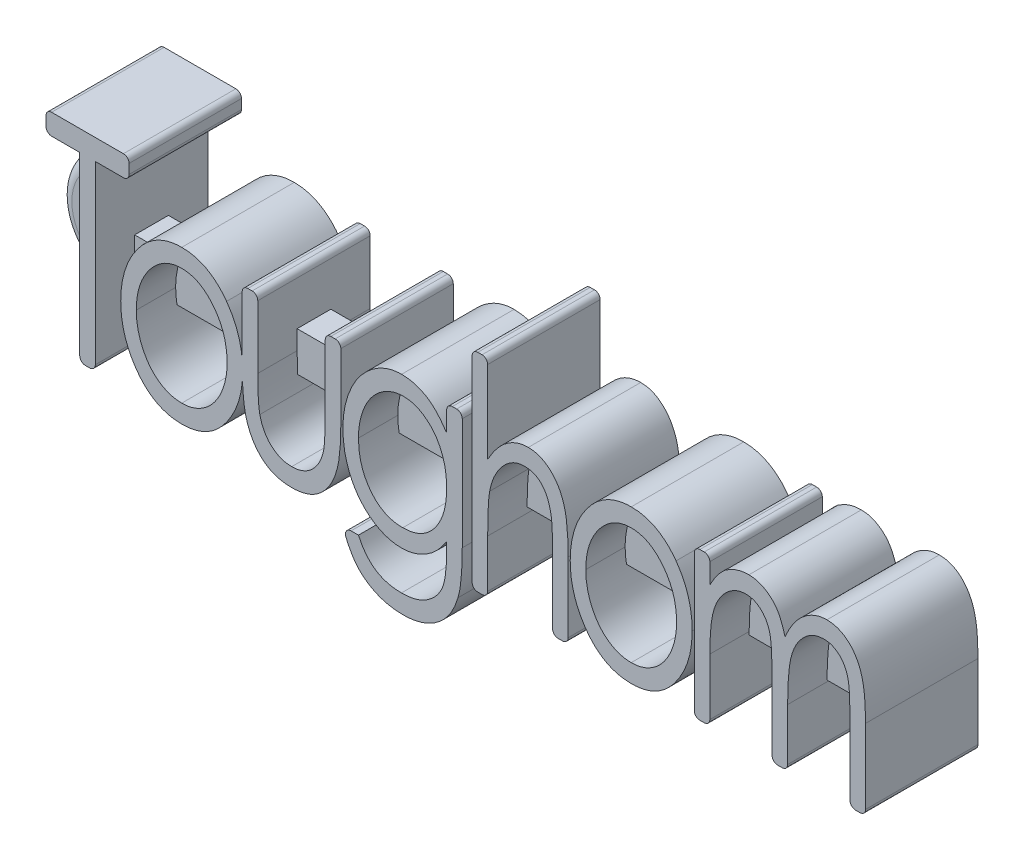
from build123d import *

# Parameters (mm, degrees)
SKETCH1_W           = 68.2
SKETCH1_H           = 3.5
BOSS_EXTRUDE1_DEPTH = 1.5
BOSS_EXTRUDE2_DEPTH = 5
BOSS_EXTRUDE3_DEPTH = 1.5
FILLET1_R           = 1
FILLET2_R           = 0.5
FILLET4_R           = 1


with BuildPart() as part:
    # Sketch1 → Boss-Extrude1 (new, symmetric)
    with BuildSketch(Plane.XY):
        Rectangle(SKETCH1_W, SKETCH1_H)
    extrude(amount=BOSS_EXTRUDE1_DEPTH, both=True)

    # Sketch2 → Boss-Extrude2 (add, symmetric)
    # profile 1 of 7: a face of its own
    with BuildSketch(Plane.XY):
        Polygon((-38.18110892, 9.153846154), (-38.18110892, 11), (-30.796493535, 11), (-30.796493535, 9.153846154), (-33.796493535, 9.153846154), (-33.796493535, -7), (-35.18110892, -7), (-35.18110892, 9.153846154), align=None)
    # profile 2 of 7: a face of its own
    with BuildSketch(Plane.XY):
        with BuildLine():
            add(Edge.make_bspline(
                [(-26.108272381, 6.384615385), (-25.911848075, 6.379244371), (-25.524505007, 6.368652887), (-24.958025603, 6.25854853), (-24.416971783, 6.088845342), (-23.899283468, 5.854648718), (-23.414217379, 5.541294481), (-22.950028442, 5.1693356), (-22.513883268, 4.725577941), (-22.25622825, 4.389933887), (-22.123897381, 4.217548077)],
                knots=[0, 0, 0, 0, 0.997600737, 1.967239891, 2.921995117, 3.876339565, 4.846055743, 5.850055787, 6.895794904, 8, 8, 8, 8], degree=3))
            add(Edge.make_bspline(
                [(-22.123897381, 4.217548077), (-22.009048053, 4.051200842), (-21.7795101, 3.718739135), (-21.490984784, 3.186587669), (-21.238251342, 2.63637492), (-21.036296082, 2.060464666), (-20.88276043, 1.461593169), (-20.770885034, 0.841057153), (-20.699877748, 0.198771914), (-20.692527722, -0.237793889), (-20.688801227, -0.459134615)],
                knots=[0, 0, 0, 0, 0.974492422, 1.947621278, 2.915467704, 3.892853539, 4.88708504, 5.894700399, 6.932604111, 8, 8, 8, 8], degree=3))
            add(Edge.make_bspline(
                [(-20.688801227, -0.459134615), (-20.694195567, -0.681642586), (-20.704834863, -1.120496664), (-20.772833197, -1.768393078), (-20.893252216, -2.394963139), (-21.057989931, -3.000740026), (-21.272008272, -3.586143933), (-21.535861783, -4.147188001), (-21.844362532, -4.689482978), (-22.19733513, -5.202442399), (-22.584945563, -5.676324223), (-23.006365549, -6.091513344), (-23.454730993, -6.445160413), (-23.934592931, -6.730800149), (-24.438510189, -6.957349096), (-24.970528248, -7.116592313), (-25.530304058, -7.212113552), (-25.913183248, -7.224472138), (-26.108272381, -7.230769231)],
                knots=[0, 0, 0, 0, 1.107894965, 2.185109244, 3.239066719, 4.281441704, 5.307577007, 6.338291467, 7.364845487, 8.410599108, 9.435040353, 10.408337498, 11.35046711, 12.27106388, 13.181883432, 14.094411748, 15.029042138, 16, 16, 16, 16], degree=3))
            add(Edge.make_bspline(
                [(-26.108272381, -7.230769231), (-26.303372718, -7.224509197), (-26.686273897, -7.212223342), (-27.247028901, -7.115981035), (-27.780691994, -6.958149345), (-28.285489577, -6.730671024), (-28.765590539, -6.445351844), (-29.213821049, -6.09032017), (-29.638928079, -5.677669716), (-30.026235973, -5.202252321), (-30.379442796, -4.689533297), (-30.687881424, -4.147174562), (-30.951751524, -3.58614752), (-31.165765419, -3.000739051), (-31.330504344, -2.394963405), (-31.450923033, -1.768393005), (-31.518921457, -1.120496683), (-31.52956074, -0.681642592), (-31.534955074, -0.459134615)],
                knots=[0, 0, 0, 0, 0.97035087, 1.904396978, 2.822082662, 3.732332818, 4.652354079, 5.593894721, 6.570857939, 7.594658757, 8.639758628, 9.6656709, 10.695741012, 11.721234828, 12.762958176, 13.816256772, 14.892797633, 16, 16, 16, 16], degree=3))
            add(Edge.make_bspline(
                [(-31.534955074, -0.459134615), (-31.531233022, -0.238986279), (-31.523872004, 0.196396194), (-31.452383447, 0.837321084), (-31.342907189, 1.45761268), (-31.18190411, 2.052013705), (-30.985028036, 2.628052803), (-30.734455867, 3.17788013), (-30.443115691, 3.70848836), (-30.214530355, 4.040283442), (-30.09985892, 4.206730769)],
                knots=[0, 0, 0, 0, 1.063876162, 2.104004247, 3.113779066, 4.10599887, 5.078075217, 6.053289624, 7.023419104, 8, 8, 8, 8], degree=3))
            add(Edge.make_bspline(
                [(-30.09985892, 4.206730769), (-29.967788876, 4.380568192), (-29.711180262, 4.718329721), (-29.272256358, 5.161474693), (-28.810530039, 5.539587942), (-28.320295334, 5.848945761), (-27.804298314, 6.08997582), (-27.26195255, 6.258201765), (-26.694505848, 6.368973013), (-26.305919428, 6.379341601), (-26.108272381, 6.384615385)],
                knots=[0, 0, 0, 0, 1.105877608, 2.148691041, 3.153713737, 4.125868282, 5.080095171, 6.03217926, 6.999105637, 8, 8, 8, 8], degree=3))
        make_face()
        with BuildLine():
            add(Edge.make_bspline(
                [(-26.11187815, 4.769230769), (-26.248025899, 4.764256564), (-26.517438982, 4.754413463), (-26.913419403, 4.679484246), (-27.294027126, 4.5609754), (-27.659823191, 4.392152394), (-28.009727116, 4.17394857), (-28.346480071, 3.909825808), (-28.665584069, 3.594644846), (-28.967675916, 3.239057506), (-29.243864891, 2.847935524), (-29.48509529, 2.432332892), (-29.692754291, 1.999070291), (-29.857650022, 1.542929391), (-29.993989813, 1.069173037), (-30.079359977, 0.572002319), (-30.141924728, 0.058077502), (-30.147501572, -0.291863245), (-30.150339689, -0.469951923)],
                knots=[0, 0, 0, 0, 0.892051984, 1.765218143, 2.632427219, 3.499707879, 4.398381485, 5.329923715, 6.299412897, 7.333506008, 8.385012576, 9.433681383, 10.480424421, 11.529892124, 12.610027243, 13.707297798, 14.833218744, 16, 16, 16, 16], degree=3))
            add(Edge.make_bspline(
                [(-30.150339689, -0.469951923), (-30.145024219, -0.69998656), (-30.134503161, -1.155300543), (-30.022795446, -1.823629075), (-29.861044253, -2.471033633), (-29.62247715, -3.083175498), (-29.329334497, -3.650482406), (-28.988417002, -4.161263064), (-28.590826756, -4.596671574), (-28.153728057, -4.965033779), (-27.678454519, -5.25312193), (-27.176631974, -5.461598792), (-26.652447695, -5.594988118), (-26.292955046, -5.608552313), (-26.11187815, -5.615384615)],
                knots=[0, 0, 0, 0, 1.139368929, 2.255184748, 3.350673064, 4.442866719, 5.503577089, 6.511720108, 7.47770502, 8.416871705, 9.336594054, 10.220769263, 11.103799257, 12, 12, 12, 12], degree=3))
            add(Edge.make_bspline(
                [(-26.11187815, -5.615384615), (-25.930788946, -5.608570518), (-25.571271862, -5.595042466), (-25.047268863, -5.461385009), (-24.545701571, -5.254331837), (-24.073127378, -4.96249254), (-23.632827491, -4.599330066), (-23.23938564, -4.159705483), (-22.897845296, -3.650718499), (-22.604638083, -3.083186794), (-22.367425007, -2.470445833), (-22.199771987, -1.824249328), (-22.089572791, -1.155218029), (-22.078839372, -0.699958865), (-22.073416612, -0.469951923)],
                knots=[0, 0, 0, 0, 0.896424748, 1.779675456, 2.664071664, 3.578931997, 4.522916774, 5.48514584, 6.493540845, 7.554516339, 8.646982988, 9.744251569, 10.860346286, 12, 12, 12, 12], degree=3))
            add(Edge.make_bspline(
                [(-22.073416612, -0.469951923), (-22.076408613, -0.291896079), (-22.082287837, 0.057980151), (-22.142689757, 0.572590697), (-22.236073403, 1.067949962), (-22.363644959, 1.544453734), (-22.53592782, 1.998199595), (-22.742076306, 2.432314717), (-22.983104466, 2.849106252), (-23.26367793, 3.23792943), (-23.565210031, 3.594734583), (-23.884416857, 3.910000807), (-24.220855902, 4.172578649), (-24.568781716, 4.394332086), (-24.935295, 4.559139189), (-25.314849812, 4.680308599), (-25.708796253, 4.754023341), (-25.976956896, 4.764140476), (-26.11187815, 4.769230769)],
                knots=[0, 0, 0, 0, 1.167383154, 2.293884921, 3.393164049, 4.471755392, 5.524513002, 6.571796016, 7.621005792, 8.677622853, 9.712249415, 10.68223872, 11.614261498, 12.506704025, 13.381600122, 14.241739258, 15.11535585, 16, 16, 16, 16], degree=3))
        make_face(mode=Mode.SUBTRACT)
    # profile 3 of 7: a face of its own
    with BuildSketch(Plane.XY):
        with BuildLine():
            Line((-20.734955074, 6.153846154), (-19.350339689, 6.153846154))
            Line((-19.350339689, 6.153846154), (-19.350339689, 0.052884615))
            add(Edge.make_bspline(
                [(-19.350339689, 0.052884615), (-19.349364506, -0.126203219), (-19.347499148, -0.468767768), (-19.341234309, -0.961626837), (-19.327359269, -1.411256426), (-19.305435417, -1.817504133), (-19.280101401, -2.180532716), (-19.252967924, -2.499409924), (-19.218238142, -2.776422087), (-19.185301645, -2.944850156), (-19.170051227, -3.022836538)],
                knots=[0, 0, 0, 0, 1.39320863, 2.664971002, 3.834342125, 4.892401155, 5.829707442, 6.665228822, 7.381967762, 8, 8, 8, 8], degree=3))
            add(Edge.make_bspline(
                [(-19.170051227, -3.022836538), (-19.120431115, -3.214646288), (-19.024519212, -3.585399948), (-18.791794556, -4.095365087), (-18.507455746, -4.547430598), (-18.155762075, -4.92766394), (-17.754416542, -5.231342745), (-17.314556358, -5.45847921), (-16.833930703, -5.591367629), (-16.501385248, -5.607289526), (-16.332310843, -5.615384615)],
                knots=[0, 0, 0, 0, 1.137446325, 2.198597258, 3.209033332, 4.197093238, 5.159258895, 6.089718797, 7.028765383, 8, 8, 8, 8], degree=3))
            add(Edge.make_bspline(
                [(-16.332310843, -5.615384615), (-16.163218593, -5.607265396), (-15.833276813, -5.591422744), (-15.358498335, -5.46130664), (-14.925448634, -5.244705137), (-14.539311251, -4.944586222), (-14.199040722, -4.579477706), (-13.918014772, -4.152785112), (-13.690096395, -3.674508671), (-13.589541107, -3.329852395), (-13.537839689, -3.152644231)],
                knots=[0, 0, 0, 0, 1.005630283, 1.962239226, 2.906425724, 3.871218594, 4.858679764, 5.865048311, 6.902295138, 8, 8, 8, 8], degree=3))
            add(Edge.make_bspline(
                [(-13.537839689, -3.152644231), (-13.522714668, -3.080658209), (-13.489096719, -2.92065694), (-13.450612912, -2.652237673), (-13.418926315, -2.331012846), (-13.39551911, -1.955691194), (-13.373096524, -1.527846111), (-13.359357193, -1.046956196), (-13.353195834, -0.514439912), (-13.351319954, -0.14182829), (-13.350339689, 0.052884615)],
                knots=[0, 0, 0, 0, 0.548823579, 1.219854442, 2.02220492, 2.957136236, 4.025854258, 5.219327833, 6.546924667, 8, 8, 8, 8], degree=3))
            Line((-13.350339689, 0.052884615), (-13.350339689, 6.153846154))
            Line((-13.350339689, 6.153846154), (-11.965724304, 6.153846154))
            Line((-11.965724304, 6.153846154), (-11.965724304, -0.25))
            add(Edge.make_bspline(
                [(-11.965724304, -0.25), (-11.967154549, -0.467557778), (-11.969928873, -0.889566337), (-11.989941061, -1.502975096), (-12.031427196, -2.073828496), (-12.079134276, -2.604712159), (-12.147863016, -3.091769782), (-12.228775315, -3.538967617), (-12.331143612, -3.942571122), (-12.475098623, -4.420579806), (-12.700840901, -4.958745616), (-13.036587882, -5.536092635), (-13.433491304, -6.042433909), (-13.817304209, -6.400110153), (-14.152791354, -6.64370257), (-14.418282851, -6.80329982), (-14.702664494, -6.93207878), (-15.000159872, -7.04131049), (-15.313547608, -7.127911196), (-15.642877708, -7.188592072), (-15.986499591, -7.225636652), (-16.220437153, -7.229037857), (-16.339522381, -7.230769231)],
                knots=[0, 0, 0, 0, 1.397698989, 2.71119214, 3.94186471, 5.07439274, 6.134732057, 7.100953584, 7.992391407, 8.808183655, 10.30677533, 11.729105738, 13.086992076, 14.425597192, 15.083568239, 15.748345675, 16.411686529, 17.08590401, 17.782777766, 18.49760152, 19.235208472, 20, 20, 20, 20], degree=3))
            add(Edge.make_bspline(
                [(-16.339522381, -7.230769231), (-16.459811867, -7.229077508), (-16.694956051, -7.225770495), (-17.039765907, -7.188568906), (-17.369128281, -7.127995497), (-17.683489497, -7.040705476), (-17.983451139, -6.931978249), (-18.270933526, -6.804386886), (-18.53742308, -6.642501236), (-18.876462668, -6.402164621), (-19.260358931, -6.040456592), (-19.662259188, -5.533171647), (-19.994964652, -4.94651889), (-20.225931563, -4.404339616), (-20.369898997, -3.919770272), (-20.472427316, -3.507785194), (-20.553280919, -3.05105092), (-20.616264878, -2.5501296), (-20.67048943, -2.007960369), (-20.710510253, -1.421196744), (-20.730859011, -0.791014963), (-20.733560111, -0.35578218), (-20.734955074, -0.131009615)],
                knots=[0, 0, 0, 0, 0.761697072, 1.488979974, 2.193798567, 2.880918402, 3.552854222, 4.213830995, 4.869303753, 5.524245692, 6.844114778, 8.193689523, 9.609276736, 11.103879885, 11.915535245, 12.809275975, 13.79192487, 14.851494079, 16.006797852, 17.243032265, 18.576185586, 20, 20, 20, 20], degree=3))
            Line((-20.734955074, -0.131009615), (-20.734955074, 6.153846154))
        make_face()
    # profile 4 of 7: a face of its own
    with BuildSketch(Plane.XY):
        with BuildLine():
            Line((-2.550339689, 6.153846154), (-1.165724304, 6.153846154))
            Line((-1.165724304, 6.153846154), (-1.165724304, -4.284855769))
            add(Edge.make_bspline(
                [(-1.165724304, -4.284855769), (-1.167283439, -4.507223982), (-1.170292674, -4.936409782), (-1.188292341, -5.556741565), (-1.216830386, -6.130207672), (-1.254915921, -6.658301707), (-1.308517624, -7.139381506), (-1.374026303, -7.574609059), (-1.445486812, -7.964666669), (-1.51264956, -8.205915174), (-1.544330074, -8.319711538)],
                knots=[0, 0, 0, 0, 1.313140422, 2.534450483, 3.664403049, 4.703595704, 5.660619967, 6.521865474, 7.302767341, 8, 8, 8, 8], degree=3))
            add(Edge.make_bspline(
                [(-1.544330074, -8.319711538), (-1.590408253, -8.46703273), (-1.680605364, -8.755411002), (-1.847548843, -9.169160642), (-2.039371485, -9.555289293), (-2.251812193, -9.918254498), (-2.490704888, -10.254839967), (-2.754783446, -10.56623221), (-3.043132742, -10.851026157), (-3.354277323, -11.108327488), (-3.686124798, -11.334481004), (-4.033463476, -11.532968013), (-4.3944452, -11.70607645), (-4.777119236, -11.836248944), (-5.172452937, -11.94695679), (-5.586662951, -12.020578587), (-6.015480976, -12.069967416), (-6.307406595, -12.074583248), (-6.455387766, -12.076923077)],
                knots=[0, 0, 0, 0, 1.107820952, 2.168537256, 3.198846454, 4.200688666, 5.184684931, 6.158030749, 7.128158633, 8.090426733, 9.052540079, 10.00719567, 10.960602632, 11.921205807, 12.905012897, 13.905218839, 14.938126187, 16, 16, 16, 16], degree=3))
            add(Edge.make_bspline(
                [(-6.455387766, -12.076923077), (-6.670962199, -12.072462935), (-7.093446228, -12.063721922), (-7.708513441, -11.963340052), (-8.293836049, -11.821204465), (-8.838327633, -11.604608699), (-9.341884886, -11.34304679), (-9.799874809, -11.039366001), (-10.208002713, -10.693610813), (-10.575413862, -10.298660416), (-10.903419146, -9.829907618), (-11.21786134, -9.281369793), (-11.515549294, -8.637414199), (-11.689466419, -8.169588998), (-11.78110892, -7.923076923)],
                knots=[0, 0, 0, 0, 1.061461245, 2.080257931, 3.064468628, 4.02485726, 4.960198824, 5.857294517, 6.727321677, 7.590891131, 8.508180099, 9.540561569, 10.704043154, 12, 12, 12, 12], degree=3))
            Line((-11.78110892, -7.923076923), (-10.396493535, -7.923076923))
            add(Edge.make_bspline(
                [(-10.396493535, -7.923076923), (-10.297542311, -8.128198331), (-10.106896057, -8.523399385), (-9.739140791, -9.045694894), (-9.340035995, -9.493233765), (-8.888812231, -9.854698372), (-8.384892363, -10.128163322), (-7.830271758, -10.323738026), (-7.219820564, -10.440115984), (-6.79485404, -10.454220783), (-6.57437815, -10.461538462)],
                knots=[0, 0, 0, 0, 1.114872187, 2.147989655, 3.119954139, 4.046708054, 4.967088834, 5.917649145, 6.919660421, 8, 8, 8, 8], degree=3))
            add(Edge.make_bspline(
                [(-6.57437815, -10.461538462), (-6.356327101, -10.454052443), (-5.933807912, -10.439546728), (-5.326703518, -10.324335468), (-4.773581019, -10.12766784), (-4.27795873, -9.856853297), (-3.846679197, -9.522990885), (-3.473447508, -9.150702578), (-3.170627765, -8.734653112), (-2.97333107, -8.35129052), (-2.850404728, -8.01165116), (-2.767139348, -7.717955045), (-2.699791074, -7.385188461), (-2.647629243, -7.014113392), (-2.604637235, -6.605196802), (-2.571848256, -6.157912395), (-2.555208609, -5.672001408), (-2.552000539, -5.335346976), (-2.550339689, -5.161057692)],
                knots=[0, 0, 0, 0, 1.36762604, 2.650059459, 3.859538652, 5.037496523, 6.177915287, 7.271197492, 8.334730679, 9.393869082, 9.96412834, 10.599183379, 11.307692762, 12.092716274, 12.949757719, 13.887429513, 14.906301644, 16, 16, 16, 16], degree=3))
            Line((-2.550339689, -5.161057692), (-2.550339689, -4.479567308))
            add(Edge.make_bspline(
                [(-2.550339689, -4.479567308), (-2.676219082, -4.673450589), (-2.922008288, -5.052022621), (-3.350342513, -5.562988586), (-3.825048659, -5.996789722), (-4.334681697, -6.359448545), (-4.871336305, -6.645920943), (-5.429660141, -6.849235065), (-6.004752764, -6.978584187), (-6.395818743, -6.992835758), (-6.592406997, -7)],
                knots=[0, 0, 0, 0, 1.112344582, 2.171938421, 3.200042036, 4.20040838, 5.176389856, 6.119262147, 7.054556032, 8, 8, 8, 8], degree=3))
            add(Edge.make_bspline(
                [(-6.592406997, -7), (-6.707942282, -6.997316622), (-6.938617966, -6.991959037), (-7.280737933, -6.945975632), (-7.61776593, -6.879188173), (-7.948857234, -6.779359591), (-8.276278428, -6.654451414), (-8.59710256, -6.497879028), (-8.91311406, -6.316532925), (-9.325375278, -6.038398863), (-9.806905451, -5.6302227), (-10.319599499, -5.06260932), (-10.762614031, -4.417390213), (-11.131513459, -3.700926706), (-11.421056613, -2.926853027), (-11.631427257, -2.111306853), (-11.755466903, -1.257410567), (-11.772458014, -0.675886573), (-11.78110892, -0.379807692)],
                knots=[0, 0, 0, 0, 0.594341688, 1.186651984, 1.773804182, 2.360956381, 2.964053426, 3.575467705, 4.196167306, 4.83781174, 6.132750582, 7.43346793, 8.763219087, 10.149283478, 11.570458848, 13.007737375, 14.476510383, 16, 16, 16, 16], degree=3))
            add(Edge.make_bspline(
                [(-11.78110892, -0.379807692), (-11.772967717, -0.082468153), (-11.756902068, 0.504294377), (-11.623828948, 1.369093277), (-11.402410924, 2.200947808), (-11.101813818, 2.996229135), (-10.723874304, 3.73619849), (-10.271145132, 4.40194366), (-9.750424915, 4.984156372), (-9.266166382, 5.403550056), (-8.850589473, 5.685558891), (-8.538118549, 5.87705689), (-8.215511236, 6.02847239), (-7.894001667, 6.163428343), (-7.564031416, 6.257924095), (-7.23202554, 6.331663377), (-6.895297977, 6.376255464), (-6.669458053, 6.38182564), (-6.556349304, 6.384615385)],
                knots=[0, 0, 0, 0, 1.510333041, 2.980454055, 4.433745133, 5.877714865, 7.292653904, 8.646179562, 9.956790963, 11.251884508, 11.888853666, 12.507884788, 13.111570812, 13.697923113, 14.277653727, 14.852668118, 15.425374966, 16, 16, 16, 16], degree=3))
            add(Edge.make_bspline(
                [(-6.556349304, 6.384615385), (-6.370776648, 6.377453627), (-6.00149124, 6.363201891), (-5.459263202, 6.255898879), (-4.935771484, 6.080201322), (-4.427543973, 5.832530301), (-3.930825399, 5.494427313), (-3.454750635, 5.044875546), (-2.984914439, 4.493583552), (-2.700078468, 4.073961465), (-2.550339689, 3.853365385)],
                knots=[0, 0, 0, 0, 0.896261828, 1.78354086, 2.659572562, 3.558258425, 4.50704087, 5.550932766, 6.712520985, 8, 8, 8, 8], degree=3))
            Line((-2.550339689, 3.853365385), (-2.550339689, 6.153846154))
        make_face()
        with BuildLine():
            add(Edge.make_bspline(
                [(-6.38687815, 4.769230769), (-6.565644928, 4.76126401), (-6.9207786, 4.745437444), (-7.44084416, 4.606227292), (-7.944579316, 4.394421036), (-8.417042026, 4.087273282), (-8.859529414, 3.713491935), (-9.249669917, 3.263224454), (-9.594926423, 2.752381576), (-9.879576522, 2.178627844), (-10.108344957, 1.563135046), (-10.274746008, 0.915593086), (-10.379227245, 0.24379146), (-10.390696737, -0.213560947), (-10.396493535, -0.444711538)],
                knots=[0, 0, 0, 0, 0.881567456, 1.751300174, 2.642352789, 3.571269243, 4.523051295, 5.494861872, 6.504265702, 7.56101116, 8.65058581, 9.742099782, 10.858834103, 12, 12, 12, 12], degree=3))
            add(Edge.make_bspline(
                [(-10.396493535, -0.444711538), (-10.392823483, -0.619103851), (-10.385619544, -0.961418248), (-10.335120859, -1.464245486), (-10.249021801, -1.942744168), (-10.129632346, -2.398978353), (-9.974727495, -2.830696564), (-9.786783914, -3.241757833), (-9.562547457, -3.6275082), (-9.307698557, -3.988109707), (-9.02460283, -4.313663958), (-8.721920611, -4.602793524), (-8.392739699, -4.84154263), (-8.047350342, -5.042440231), (-7.677646425, -5.193504469), (-7.290413327, -5.307401791), (-6.880652168, -5.372343008), (-6.601040306, -5.380481113), (-6.458993535, -5.384615385)],
                knots=[0, 0, 0, 0, 1.185092797, 2.326216796, 3.430133097, 4.486139392, 5.527352502, 6.543398971, 7.553518233, 8.555280487, 9.539607774, 10.481504186, 11.393127888, 12.296849685, 13.190325208, 14.10026404, 15.034907329, 16, 16, 16, 16], degree=3))
            add(Edge.make_bspline(
                [(-6.458993535, -5.384615385), (-6.315719225, -5.380568548), (-6.03366643, -5.37260186), (-5.622195077, -5.306635342), (-5.232381719, -5.198309773), (-4.865419787, -5.045769122), (-4.518736916, -4.848853443), (-4.195306375, -4.6066739), (-3.892969359, -4.322373209), (-3.617175646, -3.996862355), (-3.364238333, -3.63880828), (-3.149956231, -3.245850331), (-2.960285468, -2.831465775), (-2.808542502, -2.388214691), (-2.69427997, -1.917174634), (-2.61241502, -1.419357877), (-2.560775068, -0.894107199), (-2.553875174, -0.534978185), (-2.550339689, -0.350961538)],
                knots=[0, 0, 0, 0, 0.961728615, 1.89327902, 2.790232961, 3.673131094, 4.555143301, 5.460771347, 6.380107747, 7.336129127, 8.321381253, 9.318595388, 10.337300541, 11.378743002, 12.4593598, 13.588591198, 14.764401252, 16, 16, 16, 16], degree=3))
            add(Edge.make_bspline(
                [(-2.550339689, -0.350961538), (-2.556860285, -0.111503559), (-2.569556477, 0.354742871), (-2.660033031, 1.035344374), (-2.814316099, 1.674872693), (-3.030503528, 2.272658305), (-3.303806454, 2.818864184), (-3.624511872, 3.31446429), (-4.007164487, 3.740910033), (-4.431023112, 4.105597576), (-4.889650206, 4.399079456), (-5.370620261, 4.616058177), (-5.874446531, 4.742722342), (-6.215526444, 4.760366632), (-6.38687815, 4.769230769)],
                knots=[0, 0, 0, 0, 1.213241772, 2.362291902, 3.471660017, 4.540966306, 5.575987332, 6.560799048, 7.522803651, 8.468788627, 9.38620783, 10.272365513, 11.132071088, 12, 12, 12, 12], degree=3))
        make_face(mode=Mode.SUBTRACT)
    # profile 5 of 7: a face of its own
    with BuildSketch(Plane.XY):
        with BuildLine():
            Line((-0.288801227, 11.461538462), (1.095814157, 11.461538462))
            Line((1.095814157, 11.461538462), (1.095814157, 3.669471154))
            add(Edge.make_bspline(
                [(1.095814157, 3.669471154), (1.22046122, 3.884739729), (1.459380165, 4.297358685), (1.866584445, 4.851852872), (2.28587722, 5.325821315), (2.730645839, 5.710889084), (3.19542219, 6.010602822), (3.680753572, 6.228089037), (4.187567939, 6.358731877), (4.532583056, 6.375984264), (4.705189157, 6.384615385)],
                knots=[0, 0, 0, 0, 1.256690491, 2.408778505, 3.471454159, 4.449464431, 5.373097068, 6.257150511, 7.128077468, 8, 8, 8, 8], degree=3))
            add(Edge.make_bspline(
                [(4.705189157, 6.384615385), (4.880322723, 6.375481428), (5.226488659, 6.35742741), (5.730338524, 6.216331902), (6.198060122, 5.974844241), (6.631618341, 5.648712058), (7.017643053, 5.241776443), (7.363454354, 4.774189886), (7.636269892, 4.232354319), (7.827620505, 3.738273136), (7.950095697, 3.295844256), (8.031827965, 2.915445617), (8.100248042, 2.490603458), (8.152502283, 2.021145425), (8.194933491, 1.507684179), (8.22817679, 0.949894023), (8.244767404, 0.348658685), (8.247992267, -0.067299653), (8.249660311, -0.282451923)],
                knots=[0, 0, 0, 0, 0.996176206, 1.969024424, 2.951356124, 3.977766322, 5.042421952, 6.134626154, 7.27621498, 8.484766679, 9.145542465, 9.887750523, 10.698838309, 11.594295832, 12.576246137, 13.63182529, 14.775074044, 16, 16, 16, 16], degree=3))
            Line((8.249660311, -0.282451923), (8.249660311, -7))
            Line((8.249660311, -7), (6.865044926, -7))
            Line((6.865044926, -7), (6.865044926, -0.8125))
            add(Edge.make_bspline(
                [(6.865044926, -0.8125), (6.863666893, -0.633416277), (6.861031053, -0.290872848), (6.860024749, 0.199589674), (6.847919442, 0.644294975), (6.834462676, 1.04220334), (6.816151949, 1.393184543), (6.796459505, 1.697643369), (6.767321977, 1.954744496), (6.745148179, 2.110618159), (6.735237234, 2.180288462)],
                knots=[0, 0, 0, 0, 1.433671176, 2.74226285, 3.926088526, 4.994794622, 5.929342253, 6.739627381, 7.436655691, 8, 8, 8, 8], degree=3))
            add(Edge.make_bspline(
                [(6.735237234, 2.180288462), (6.6954772, 2.383372906), (6.620048516, 2.76864401), (6.440273863, 3.299211949), (6.213854899, 3.751258107), (5.937401038, 4.122076107), (5.615641819, 4.417018495), (5.240755386, 4.621918632), (4.821554896, 4.749570934), (4.525842789, 4.762545039), (4.373458388, 4.769230769)],
                knots=[0, 0, 0, 0, 1.286018597, 2.439703376, 3.472813688, 4.417745281, 5.301809853, 6.165149782, 7.05447716, 8, 8, 8, 8], degree=3))
            add(Edge.make_bspline(
                [(4.373458388, 4.769230769), (4.283119874, 4.766739332), (4.103595243, 4.76178824), (3.838113814, 4.71326366), (3.58138484, 4.632263475), (3.328619913, 4.525291694), (3.089200749, 4.376024671), (2.847189649, 4.209542702), (2.622143529, 4.000030852), (2.327615077, 3.686758943), (1.995457714, 3.242544084), (1.675271767, 2.644569721), (1.420175104, 1.990085989), (1.32016123, 1.524652857), (1.26889108, 1.286057692)],
                knots=[0, 0, 0, 0, 0.644825769, 1.28142587, 1.919587189, 2.565555052, 3.235497232, 3.931132674, 4.660544456, 5.425856618, 7.00215079, 8.604141558, 10.259179793, 12, 12, 12, 12], degree=3))
            add(Edge.make_bspline(
                [(1.26889108, 1.286057692), (1.255084313, 1.198400824), (1.224899459, 1.006762219), (1.189434442, 0.692873907), (1.162376342, 0.327139941), (1.136237388, -0.088684507), (1.120131268, -0.556425549), (1.104484226, -1.073222507), (1.098778852, -1.641816737), (1.096831956, -2.03726028), (1.095814157, -2.243990385)],
                knots=[0, 0, 0, 0, 0.601974854, 1.316059127, 2.1422104, 3.089815509, 4.142494093, 5.317148409, 6.597457965, 8, 8, 8, 8], degree=3))
            Line((1.095814157, -2.243990385), (1.095814157, -7))
            Line((1.095814157, -7), (-0.288801227, -7))
            Line((-0.288801227, -7), (-0.288801227, 11.461538462))
        make_face()
    # profile 6 of 7: a face of its own
    with BuildSketch(Plane.XY):
        with BuildLine():
            add(Edge.make_bspline(
                [(13.860958388, 6.384615385), (14.057382694, 6.379244371), (14.444725762, 6.368652887), (15.011205166, 6.25854853), (15.552258986, 6.088845342), (16.069947301, 5.854648718), (16.55501339, 5.541294481), (17.019202327, 5.1693356), (17.455347501, 4.725577941), (17.71300252, 4.389933887), (17.845333388, 4.217548077)],
                knots=[0, 0, 0, 0, 0.997600737, 1.967239891, 2.921995117, 3.876339565, 4.846055743, 5.850055787, 6.895794904, 8, 8, 8, 8], degree=3))
            add(Edge.make_bspline(
                [(17.845333388, 4.217548077), (17.960182717, 4.051200842), (18.18972067, 3.718739135), (18.478245985, 3.186587669), (18.730979427, 2.63637492), (18.932934687, 2.060464666), (19.086470339, 1.461593169), (19.198345735, 0.841057153), (19.269353021, 0.198771914), (19.276703047, -0.237793889), (19.280429542, -0.459134615)],
                knots=[0, 0, 0, 0, 0.974492422, 1.947621278, 2.915467704, 3.892853539, 4.88708504, 5.894700399, 6.932604111, 8, 8, 8, 8], degree=3))
            add(Edge.make_bspline(
                [(19.280429542, -0.459134615), (19.275035202, -0.681642586), (19.264395907, -1.120496664), (19.196397573, -1.768393078), (19.075978553, -2.394963139), (18.911240838, -3.000740026), (18.697222497, -3.586143933), (18.433368987, -4.147188001), (18.124868237, -4.689482978), (17.77189564, -5.202442399), (17.384285206, -5.676324223), (16.96286522, -6.091513344), (16.514499777, -6.445160413), (16.034637838, -6.730800149), (15.53072058, -6.957349096), (14.998702522, -7.116592313), (14.438926711, -7.212113552), (14.056047521, -7.224472138), (13.860958388, -7.230769231)],
                knots=[0, 0, 0, 0, 1.107894965, 2.185109244, 3.239066719, 4.281441704, 5.307577007, 6.338291467, 7.364845487, 8.410599108, 9.435040353, 10.408337498, 11.35046711, 12.27106388, 13.181883432, 14.094411748, 15.029042138, 16, 16, 16, 16], degree=3))
            add(Edge.make_bspline(
                [(13.860958388, -7.230769231), (13.665858051, -7.224509197), (13.282956873, -7.212223342), (12.722201868, -7.115981035), (12.188538775, -6.958149345), (11.683741192, -6.730671024), (11.20364023, -6.445351844), (10.755409721, -6.09032017), (10.33030269, -5.677669716), (9.942994796, -5.202252321), (9.589787973, -4.689533297), (9.281349345, -4.147174562), (9.017479245, -3.58614752), (8.80346535, -3.000739051), (8.638726425, -2.394963405), (8.518307736, -1.768393005), (8.450309313, -1.120496683), (8.439670029, -0.681642592), (8.434275696, -0.459134615)],
                knots=[0, 0, 0, 0, 0.97035087, 1.904396978, 2.822082662, 3.732332818, 4.652354079, 5.593894721, 6.570857939, 7.594658757, 8.639758628, 9.6656709, 10.695741012, 11.721234828, 12.762958176, 13.816256772, 14.892797633, 16, 16, 16, 16], degree=3))
            add(Edge.make_bspline(
                [(8.434275696, -0.459134615), (8.437997747, -0.238986279), (8.445358765, 0.196396194), (8.516847322, 0.837321084), (8.62632358, 1.45761268), (8.787326659, 2.052013705), (8.984202733, 2.628052803), (9.234774902, 3.17788013), (9.526115079, 3.70848836), (9.754700415, 4.040283442), (9.86937185, 4.206730769)],
                knots=[0, 0, 0, 0, 1.063876162, 2.104004247, 3.113779066, 4.10599887, 5.078075217, 6.053289624, 7.023419104, 8, 8, 8, 8], degree=3))
            add(Edge.make_bspline(
                [(9.86937185, 4.206730769), (10.001441893, 4.380568192), (10.258050507, 4.718329721), (10.696974411, 5.161474693), (11.158700731, 5.539587942), (11.648935435, 5.848945761), (12.164932455, 6.08997582), (12.707278219, 6.258201765), (13.274724921, 6.368973013), (13.663311341, 6.379341601), (13.860958388, 6.384615385)],
                knots=[0, 0, 0, 0, 1.105877608, 2.148691041, 3.153713737, 4.125868282, 5.080095171, 6.03217926, 6.999105637, 8, 8, 8, 8], degree=3))
        make_face()
        with BuildLine():
            add(Edge.make_bspline(
                [(13.857352619, 4.769230769), (13.72120487, 4.764256564), (13.451791787, 4.754413463), (13.055811366, 4.679484246), (12.675203643, 4.5609754), (12.309407578, 4.392152394), (11.959503654, 4.17394857), (11.622750698, 3.909825808), (11.3036467, 3.594644846), (11.001554853, 3.239057506), (10.725365878, 2.847935524), (10.484135479, 2.432332892), (10.276476478, 1.999070291), (10.111580747, 1.542929391), (9.975240956, 1.069173037), (9.889870792, 0.572002319), (9.827306041, 0.058077502), (9.821729197, -0.291863245), (9.81889108, -0.469951923)],
                knots=[0, 0, 0, 0, 0.892051984, 1.765218143, 2.632427219, 3.499707879, 4.398381485, 5.329923715, 6.299412897, 7.333506008, 8.385012576, 9.433681383, 10.480424421, 11.529892124, 12.610027243, 13.707297798, 14.833218744, 16, 16, 16, 16], degree=3))
            add(Edge.make_bspline(
                [(9.81889108, -0.469951923), (9.82420655, -0.69998656), (9.834727608, -1.155300543), (9.946435324, -1.823629075), (10.108186517, -2.471033633), (10.346753619, -3.083175498), (10.639896273, -3.650482406), (10.980813767, -4.161263064), (11.378404013, -4.596671574), (11.815502712, -4.965033779), (12.290776251, -5.25312193), (12.792598796, -5.461598792), (13.316783074, -5.594988118), (13.676275723, -5.608552313), (13.857352619, -5.615384615)],
                knots=[0, 0, 0, 0, 1.139368929, 2.255184748, 3.350673064, 4.442866719, 5.503577089, 6.511720108, 7.47770502, 8.416871705, 9.336594054, 10.220769263, 11.103799257, 12, 12, 12, 12], degree=3))
            add(Edge.make_bspline(
                [(13.857352619, -5.615384615), (14.038441823, -5.608570518), (14.397958907, -5.595042466), (14.921961907, -5.461385009), (15.423529198, -5.254331837), (15.896103392, -4.96249254), (16.336403278, -4.599330066), (16.729845129, -4.159705483), (17.071385473, -3.650718499), (17.364592686, -3.083186794), (17.601805762, -2.470445833), (17.769458782, -1.824249328), (17.879657978, -1.155218029), (17.890391398, -0.699958865), (17.895814157, -0.469951923)],
                knots=[0, 0, 0, 0, 0.896424748, 1.779675456, 2.664071664, 3.578931997, 4.522916774, 5.48514584, 6.493540845, 7.554516339, 8.646982988, 9.744251569, 10.860346286, 12, 12, 12, 12], degree=3))
            add(Edge.make_bspline(
                [(17.895814157, -0.469951923), (17.892822156, -0.291896079), (17.886942933, 0.057980151), (17.826541012, 0.572590697), (17.733157367, 1.067949962), (17.60558581, 1.544453734), (17.433302949, 1.998199595), (17.227154463, 2.432314717), (16.986126303, 2.849106252), (16.705552839, 3.23792943), (16.404020739, 3.594734583), (16.084813912, 3.910000807), (15.748374868, 4.172578649), (15.400449053, 4.394332086), (15.033935769, 4.559139189), (14.654380957, 4.680308599), (14.260434516, 4.754023341), (13.992273873, 4.764140476), (13.857352619, 4.769230769)],
                knots=[0, 0, 0, 0, 1.167383154, 2.293884921, 3.393164049, 4.471755392, 5.524513002, 6.571796016, 7.621005792, 8.677622853, 9.712249415, 10.68223872, 11.614261498, 12.506704025, 13.381600122, 14.241739258, 15.11535585, 16, 16, 16, 16], degree=3))
        make_face(mode=Mode.SUBTRACT)
    # profile 7 of 7: a face of its own
    with BuildSketch(Plane.XY):
        with BuildLine():
            Line((19.465044926, 6.153846154), (20.849660311, 6.153846154))
            Line((20.849660311, 6.153846154), (20.849660311, 3.867788462))
            add(Edge.make_bspline(
                [(20.849660311, 3.867788462), (20.960342819, 4.067087761), (21.170490528, 4.445488032), (21.52270385, 4.949352736), (21.868807094, 5.378731701), (22.126674094, 5.60871716), (22.248698773, 5.717548077)],
                knots=[0, 0, 0, 0, 1.171933473, 2.225095347, 3.16010125, 4, 4, 4, 4], degree=3))
            add(Edge.make_bspline(
                [(22.248698773, 5.717548077), (22.413101124, 5.819908188), (22.734251333, 6.019862574), (23.253651604, 6.23058039), (23.785819301, 6.357849206), (24.14585771, 6.375701757), (24.32562185, 6.384615385)],
                knots=[0, 0, 0, 0, 1.048657587, 2.048490186, 3.025627617, 4, 4, 4, 4], degree=3))
            add(Edge.make_bspline(
                [(24.32562185, 6.384615385), (24.447280599, 6.3790949), (24.69007473, 6.368077679), (25.048984071, 6.299804948), (25.395810431, 6.177236659), (25.729334527, 6.011563337), (26.043673399, 5.807972323), (26.331833168, 5.571169959), (26.589986414, 5.30359671), (26.816862402, 4.995358666), (27.028258628, 4.642514025), (27.210226533, 4.223335028), (27.390830786, 3.742296921), (27.484960624, 3.392813641), (27.534756465, 3.207932692)],
                knots=[0, 0, 0, 0, 0.894318559, 1.784789816, 2.673155522, 3.589665775, 4.515830902, 5.419523397, 6.325415028, 7.240562059, 8.226788069, 9.341658935, 10.593704917, 12, 12, 12, 12], degree=3))
            add(Edge.make_bspline(
                [(27.534756465, 3.207932692), (27.644973861, 3.454523339), (27.856707944, 3.928238433), (28.245125259, 4.57081901), (28.670860067, 5.122035545), (29.137248168, 5.577914164), (29.637387752, 5.933449047), (30.158202753, 6.196773382), (30.703489498, 6.355034635), (31.074642027, 6.37478004), (31.25951608, 6.384615385)],
                knots=[0, 0, 0, 0, 1.247522168, 2.39656325, 3.461211686, 4.459136641, 5.39944971, 6.286422375, 7.146453235, 8, 8, 8, 8], degree=3))
            add(Edge.make_bspline(
                [(31.25951608, 6.384615385), (31.429727349, 6.376178866), (31.765360796, 6.359543199), (32.253792087, 6.230389324), (32.706857561, 6.007733214), (33.126364369, 5.707122131), (33.502816054, 5.328668225), (33.828055641, 4.879746211), (34.104777304, 4.36507733), (34.284431352, 3.884310554), (34.402844589, 3.456767233), (34.480426249, 3.092921717), (34.5500254, 2.69142653), (34.601434683, 2.251887171), (34.646118647, 1.774713964), (34.672743196, 1.258651364), (34.691308339, 0.704462085), (34.694281279, 0.32213287), (34.695814157, 0.125)],
                knots=[0, 0, 0, 0, 1.021070567, 2.013412143, 3.007378834, 4.036575433, 5.097825748, 6.197552405, 7.353325105, 8.595615841, 9.269603917, 10.015462958, 10.828037795, 11.714963733, 12.671344109, 13.704781296, 14.81656166, 16, 16, 16, 16], degree=3))
            Line((34.695814157, 0.125), (34.695814157, -7))
            Line((34.695814157, -7), (33.311198773, -7))
            Line((33.311198773, -7), (33.311198773, 0.132211538))
            add(Edge.make_bspline(
                [(33.311198773, 0.132211538), (33.310559709, 0.300486842), (33.30933165, 0.623853785), (33.298619352, 1.087879011), (33.280963703, 1.511062923), (33.256389837, 1.892242963), (33.224431788, 2.232627402), (33.185271697, 2.532194099), (33.140247474, 2.79139481), (33.068680952, 3.07773389), (32.957378721, 3.394077549), (32.781547734, 3.73515126), (32.5607437, 4.034953267), (32.306463018, 4.296621502), (32.013302479, 4.506427304), (31.691807605, 4.660716122), (31.341707302, 4.754767531), (31.099046405, 4.76432942), (30.974660311, 4.769230769)],
                knots=[0, 0, 0, 0, 1.379909185, 2.651708276, 3.805941215, 4.852978562, 5.783702266, 6.608923511, 7.330047616, 7.939622565, 9.027610697, 10.072418919, 11.073883027, 12.070533896, 13.052455124, 14.013527241, 14.981749467, 16, 16, 16, 16], degree=3))
            add(Edge.make_bspline(
                [(30.974660311, 4.769230769), (30.820904921, 4.761626689), (30.513134527, 4.746405688), (30.067067518, 4.599157252), (29.640199558, 4.372858608), (29.248079801, 4.051316949), (28.887744083, 3.662703651), (28.575134632, 3.207373581), (28.321299607, 2.689819147), (28.147923308, 2.214886327), (28.039805783, 1.787182636), (27.969018771, 1.41137991), (27.908599969, 0.985407631), (27.858851224, 0.509090204), (27.820152319, -0.017609582), (27.790543227, -0.594645965), (27.778611852, -1.222309463), (27.774745154, -1.657450935), (27.772737234, -1.883413462)],
                knots=[0, 0, 0, 0, 0.898028184, 1.79757268, 2.72350492, 3.715183115, 4.751339907, 5.81945548, 6.937089224, 8.119533788, 8.773471509, 9.519018729, 10.358283575, 11.292740113, 12.323454074, 13.451218336, 14.676455408, 16, 16, 16, 16], degree=3))
            Line((27.772737234, -1.883413462), (27.772737234, -7))
            Line((27.772737234, -7), (26.38812185, -7))
            Line((26.38812185, -7), (26.38812185, -0.311298077))
            add(Edge.make_bspline(
                [(26.38812185, -0.311298077), (26.387475835, -0.122591192), (26.386233067, 0.240432883), (26.375600103, 0.760945477), (26.357847968, 1.234584924), (26.333659419, 1.660271649), (26.300289938, 2.037586633), (26.266798688, 2.368900506), (26.220952771, 2.651871682), (26.149788794, 2.962191545), (26.038360534, 3.300373863), (25.866587854, 3.66744999), (25.643554788, 3.986931901), (25.383854591, 4.262116362), (25.091333415, 4.488905864), (24.76685339, 4.654475119), (24.411586826, 4.750858567), (24.16635006, 4.763008749), (24.04076608, 4.769230769)],
                knots=[0, 0, 0, 0, 1.442659481, 2.775310106, 3.979909877, 5.066085876, 6.034440002, 6.875647806, 7.611320077, 8.224284655, 9.308126128, 10.327370997, 11.311251607, 12.273219661, 13.210514908, 14.126903344, 15.040800711, 16, 16, 16, 16], degree=3))
            add(Edge.make_bspline(
                [(24.04076608, 4.769230769), (23.893037467, 4.761386821), (23.59743286, 4.745691098), (23.16608658, 4.601039276), (22.750640549, 4.377842793), (22.356349961, 4.069261974), (21.993175872, 3.689495708), (21.683221722, 3.238837927), (21.417382973, 2.732507054), (21.241553323, 2.262912531), (21.128877872, 1.845981851), (21.0534455, 1.489668589), (20.988321151, 1.093961308), (20.941396075, 0.657895109), (20.895540999, 0.183407657), (20.868151526, -0.33023586), (20.855370402, -0.884548745), (20.851610797, -1.266821008), (20.849660311, -1.465144231)],
                knots=[0, 0, 0, 0, 0.91128202, 1.82347317, 2.784601502, 3.817986041, 4.906375212, 6.022042265, 7.189149255, 8.435921352, 9.113974711, 9.859010574, 10.687587681, 11.593060163, 12.570945671, 13.635620039, 14.773357369, 16, 16, 16, 16], degree=3))
            Line((20.849660311, -1.465144231), (20.849660311, -7))
            Line((20.849660311, -7), (19.465044926, -7))
            Line((19.465044926, -7), (19.465044926, 6.153846154))
        make_face()
    extrude(amount=BOSS_EXTRUDE2_DEPTH, both=True)

    # Sketch3 → Boss-Extrude3 (add, symmetric)
    with BuildSketch(Plane.XY):
        with BuildLine():
            Line((-35.18110892, 6.734681588), (-35.18110892, 5.034681588))
            ThreePointArc((-35.18110892, 5.034681588), (-38.68110892, 1.534681588), (-35.18110892, -1.965318412))
            Line((-35.18110892, -1.965318412), (-35.18110892, -3.665318412))
            ThreePointArc((-35.18110892, -3.665318412), (-40.38110892, 1.534681588), (-35.18110892, 6.734681588))
        make_face()
    extrude(amount=BOSS_EXTRUDE3_DEPTH, both=True)

    # Fillet1
    fillet1_edges = [part.edges().sort_by_distance(p)[0] for p in [
        (-40.38110892, 1.534681588, -1.5),
        (-35.18110892, 6.734681588, 0),
        (-35.18110892, -2.815318412, -1.5),
        (-35.18110892, -3.665318412, 0),
        (-35.18110892, 5.884681588, -1.5),
        (-40.38110892, 1.534681588, 1.5),
        (-35.18110892, -2.815318412, 1.5),
        (-35.18110892, 5.884681588, 1.5),
    ]]
    fillet(fillet1_edges, radius=FILLET1_R)

    # Fillet2
    fillet2_edges = [part.edges().sort_by_distance(p)[0] for p in [
        (-2.550339689, 6.153846154, 0),
        (-11.78110892, -7.923076923, 2.5),
        (-1.165724304, 6.153846154, 0),
        (-38.18110892, 9.153846154, 0),
        (-35.18110892, -7, 0),
        (-33.796493535, -7, 0),
        (-30.796493535, 9.153846154, 0),
        (-30.796493535, 11, 0),
        (-38.18110892, 11, 0),
        (-0.288801227, 11.461538462, 0),
        (-0.288801227, -7, 0),
        (1.095814157, -7, 0),
        (6.865044926, -7, 0),
        (8.249660311, -7, 0),
        (1.095814157, 11.461538462, 0),
        (19.465044926, 6.153846154, 0),
        (19.465044926, -7, 0),
        (20.849660311, -7, 0),
        (26.38812185, -7, 0),
        (27.772737234, -7, 0),
        (33.311198773, -7, 0),
        (34.695814157, -7, 0),
        (20.849660311, 6.153846154, 0),
        (-20.734955074, 6.153846154, 0),
        (-11.965724304, 6.153846154, 0),
        (-13.350339689, 6.153846154, 0),
        (-19.350339689, 6.153846154, 0),
    ]]
    fillet(fillet2_edges, radius=FILLET2_R)

    # Fillet4
    fillet4_edges = [part.edges().sort_by_distance(p)[0] for p in [
        (-35.18110892, -1.965318412, 0),
        (-35.18110892, 5.034681588, 0),
    ]]
    fillet(fillet4_edges, radius=FILLET4_R - 0.0001)  # a hair under: the kernel refuses the full size


solid = part.part
